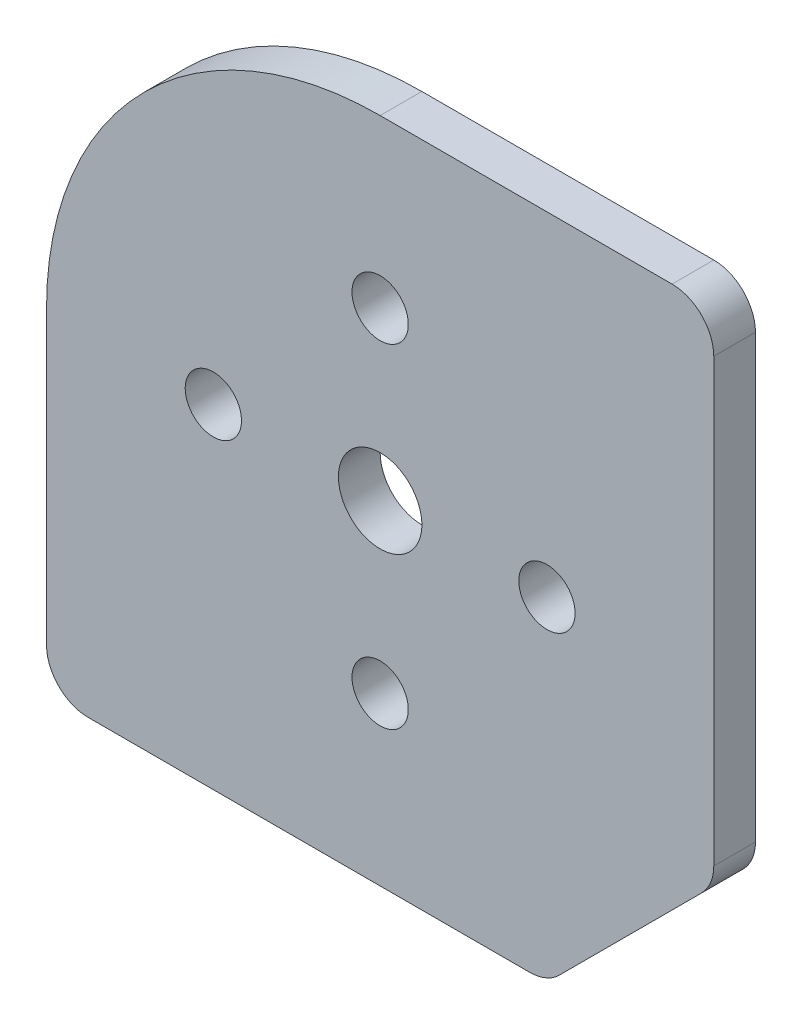
from build123d import *

# Parameters (mm, degrees)
BASE_FLANGE1_DEPTH = 10
SKETCH6_R          = 6.75
SKETCH6_R_2        = 10
CUT_EXTRUDE1_DEPTH = 496.075751779
FILLET1_R          = 10


# Sheet-metal steps are written as plain solids
with BuildPart() as part:
    # Sketch1 → Base-Flange1 (new body)
    with BuildSketch(Plane.XY):
        with BuildLine():
            Line((-350, 190), (-350, 270))
            ThreePointArc((-350, 270), (-326.568542495, 326.568542495), (-270, 350))
            Line((-270, 350), (-190, 350))
            Line((-190, 350), (-190, 230))
            Line((-190, 230), (-230, 190))
            Line((-230, 190), (-350, 190))
        make_face()
    extrude(amount=BASE_FLANGE1_DEPTH)

    # Sketch6 → Cut-Extrude1 (cut, through all)
    with BuildSketch(Plane(origin=(0, 0, 0), x_dir=(-1, 0, 0), z_dir=(0, 0, -1))):
        with Locations((270, 310)):
            Circle(SKETCH6_R)
        with Locations((310, 270)):
            Circle(SKETCH6_R)
        with Locations((230, 270)):
            Circle(SKETCH6_R)
        with Locations((270, 230)):
            Circle(SKETCH6_R)
        with Locations((270, 270)):
            Circle(SKETCH6_R_2)
    extrude(amount=-CUT_EXTRUDE1_DEPTH, mode=Mode.SUBTRACT)

    # Fillet1
    fillet1_edges = [part.edges().sort_by_distance(p)[0] for p in [
        (-190, 350, 5),
        (-190, 230, 5),
        (-230, 190, 5),
        (-350, 190, 5),
    ]]
    fillet(fillet1_edges, radius=FILLET1_R)


solid = part.part
